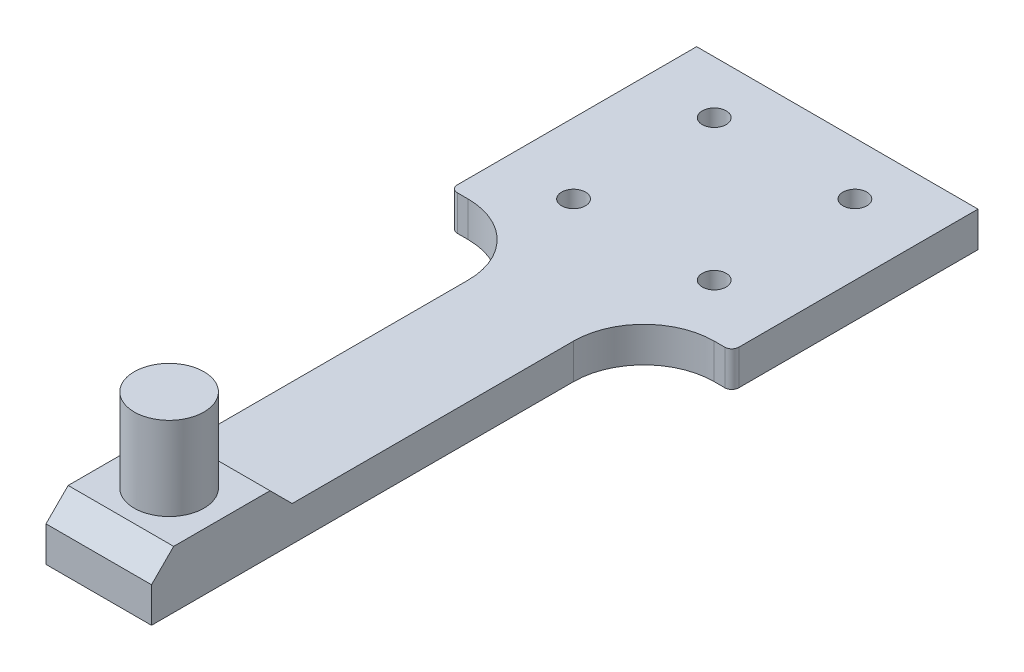
from build123d import *

# Parameters (mm, degrees)
SKETCH1_W                    = 40
SKETCH1_H                    = 35
BOSS_EXTRUDE1_DEPTH          = 5
M3_CLEARANCE_HOLE1_OUTLINE_R = 1.7
M3_CLEARANCE_HOLE1_DEPTH     = 5
SKETCH7_W                    = 15
SKETCH7_H                    = 70
BOSS_EXTRUDE3_DEPTH          = 5
SKETCH8_R                    = 4.96
BOSS_EXTRUDE4_DEPTH          = 15
SKETCH9_W                    = 15
SKETCH9_H                    = 12
BOSS_EXTRUDE5_DEPTH          = 3.15
FILLET1_R                    = 10
FILLET2_R                    = 1
CHAMFER1_SIZE                = 4


# Read off the part's stored shape, not the designer's step: M3 Clearance Hole1
with BuildPart() as part:
    # Sketch1 → Boss-Extrude1 (new body)
    with BuildSketch(Plane(origin=(0, 0, 0), x_dir=(1, 0, 0), z_dir=(0, 1, 0))):
        Rectangle(SKETCH1_W, SKETCH1_H)
    extrude(amount=BOSS_EXTRUDE1_DEPTH)

    # M3 Clearance Hole1 outline → M3 Clearance Hole1 (cut)
    with BuildSketch(Plane(origin=(0, 0, 0), x_dir=(1, 0, 0), z_dir=(0, 1, 0))):
        with Locations((10, 10)):
            Circle(M3_CLEARANCE_HOLE1_OUTLINE_R)
        with Locations((-10, -10)):
            Circle(M3_CLEARANCE_HOLE1_OUTLINE_R)
        with Locations((-10, 10)):
            Circle(M3_CLEARANCE_HOLE1_OUTLINE_R)
        with Locations((10, -10)):
            Circle(M3_CLEARANCE_HOLE1_OUTLINE_R)
    extrude(amount=M3_CLEARANCE_HOLE1_DEPTH, mode=Mode.SUBTRACT)

    # Sketch7 → Boss-Extrude3 (add, through all)
    with BuildSketch(Plane(origin=(0, 5, 0), x_dir=(1, 0, 0), z_dir=(0, 1, 0))):
        with Locations((0, -52.5)):
            Rectangle(SKETCH7_W, SKETCH7_H)
    extrude(amount=-BOSS_EXTRUDE3_DEPTH)

    # Sketch8 → Boss-Extrude4 (add)
    with BuildSketch(Plane(origin=(0, 5, 0), x_dir=(1, 0, 0), z_dir=(0, 1, 0))):
        with Locations(Location((0, -77.5, 0), (0, 0, 270))):
            Circle(SKETCH8_R)
    extrude(amount=BOSS_EXTRUDE4_DEPTH)

    # Sketch9 → Boss-Extrude5 (add)
    with BuildSketch(Plane(origin=(0, 5, 0), x_dir=(1, 0, 0), z_dir=(0, 1, 0))):
        with Locations((0, -77.5)):
            Rectangle(SKETCH9_W, SKETCH9_H)
    extrude(amount=BOSS_EXTRUDE5_DEPTH)

    # Fillet1
    fillet1_edges = [part.edges().sort_by_distance(p)[0] for p in [
        (-7.5, 2.5, 17.5),
        (7.5, 2.5, 17.5),
    ]]
    fillet(fillet1_edges, radius=FILLET1_R)

    # Fillet2
    fillet2_edges = [part.edges().sort_by_distance(p)[0] for p in [
        (20, 2.5, 17.5),
        (-20, 2.5, 17.5),
    ]]
    fillet(fillet2_edges, radius=FILLET2_R)

    # Chamfer1
    # the kernel refuses this chamfer: 4 mm, written as the material it adds along each edge
    with BuildSketch(Plane(origin=(7.5, 5, 71.5), x_dir=(0, -0.027495876610586296, -0.9996219169112968), z_dir=(-1, 0, 0))) as chamfer1_piece_1_section:
        Polygon((CHAMFER1_SIZE * 0.999621916911, -CHAMFER1_SIZE * 0.0274958766106), (-CHAMFER1_SIZE * 0.0274958766106, -CHAMFER1_SIZE * 0.999621916911), (0, 0), align=None)
    chamfer1_piece_1 = extrude(amount=15, mode=Mode.PRIVATE)
    chamfer1_piece_1 = split(chamfer1_piece_1, bisect_by=Plane(origin=(0, 8.15, 70.111191503), z_dir=(0, -1, 0)), keep=Keep.TOP, mode=Mode.PRIVATE)
    add(chamfer1_piece_1)
    with BuildSketch(Plane(origin=(-7.5, 5, 83.5), x_dir=(0, -0.027495876610586296, 0.9996219169112968), z_dir=(1, 0, 0))) as chamfer1_piece_2_section:
        Polygon((CHAMFER1_SIZE * 0.999621916911, -CHAMFER1_SIZE * 0.0274958766106), (-CHAMFER1_SIZE * 0.0274958766106, -CHAMFER1_SIZE * 0.999621916911), (0, 0), align=None)
    chamfer1_piece_2 = extrude(amount=15, mode=Mode.PRIVATE)
    chamfer1_piece_2 = split(chamfer1_piece_2, bisect_by=Plane(origin=(0, 6.188699504, 87.5), z_dir=(0, 0, -1)), keep=Keep.TOP, mode=Mode.PRIVATE)
    chamfer1_piece_2 = split(chamfer1_piece_2, bisect_by=Plane(origin=(0, 8.15, 84.884013224), z_dir=(0, -1, 0)), keep=Keep.TOP, mode=Mode.PRIVATE)
    add(chamfer1_piece_2)


solid = part.part
